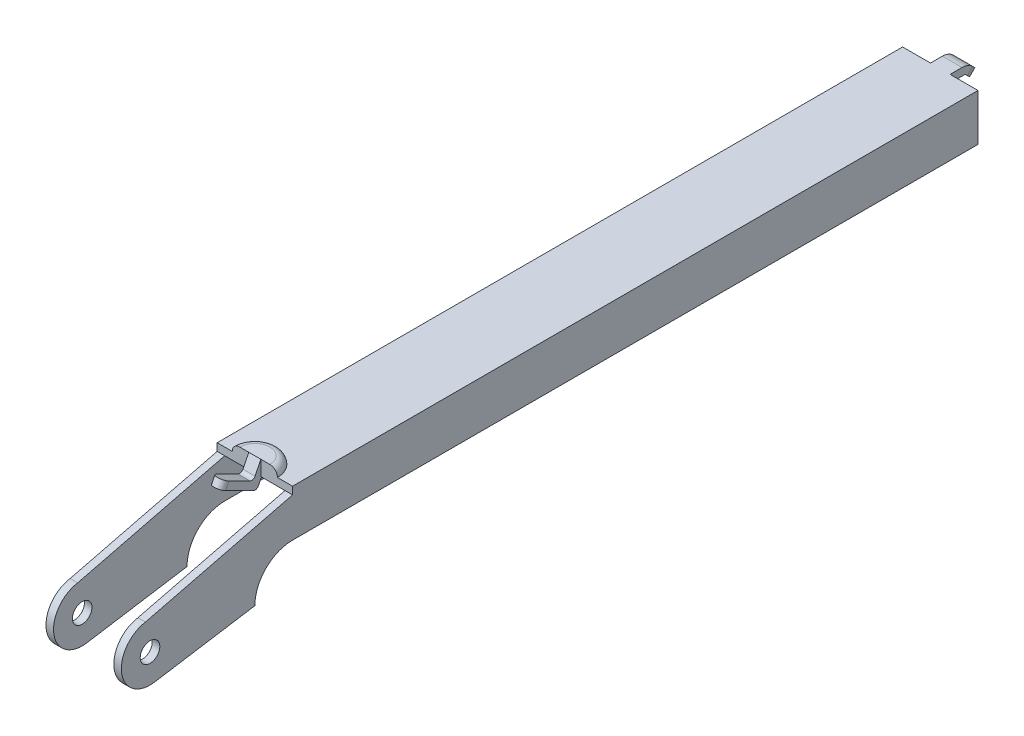
from build123d import *

# Parameters (mm, degrees)
SKETCH1_W                = 12.7
SKETCH1_H                = 115.490625
BOSS_EXTRUDE1_DEPTH      = 1.27
SKETCH2_W                = 5.08
SKETCH2_H                = 24.638
CUT_EXTRUDE1_DEPTH       = 1.27
SKETCH3_R                = 1.778
CUT_EXTRUDE2_DEPTH       = 1.27
SKETCH4_R                = 1.778
CUT_EXTRUDE3_DEPTH       = 1.27
CUT_EXTRUDE4_DEPTH       = 1.27
REVOLVE1_ANGLE           = 180
BOSS_EXTRUDE2_DEPTH      = 1.651
BOSS_EXTRUDE2_DEPTH_BACK = 1.651
FILLET1_R                = 2.54
CUT_EXTRUDE5_START       = -1.27
CUT_EXTRUDE5_DEPTH       = 1.27
BOSS_EXTRUDE3_DEPTH      = 1.016
BOSS_EXTRUDE3_DEPTH_BACK = 1.016
FILLET2_R                = 0.635
FILLET3_R                = 0.635
FILLET4_R                = 0.635
CUT_EXTRUDE6_DEPTH       = 112.292512614
SKETCH13_W               = 115.490625
SKETCH13_H               = 7.874
BOSS_EXTRUDE4_DEPTH      = 1.27
FILLET6_R                = 0.635
BOSS_EXTRUDE5_DEPTH      = 1.27
CUT_EXTRUDE7_REACH       = 147.742
SKETCH16_R               = 1.651


# Read off the part's stored shape, not the designer's step: Cut-Extrude5
with BuildPart() as part:
    # Sketch1 → Boss-Extrude1 (new body)
    with BuildSketch(Plane(origin=(0, 0, 0), x_dir=(1, 0, 0), z_dir=(0, 1, 0))):
        with Locations((6.35, -57.7453125)):
            Rectangle(SKETCH1_W, SKETCH1_H)
    boss_extrude1 = extrude(amount=BOSS_EXTRUDE1_DEPTH)

    # Sketch2 → Cut-Extrude1 (cut)
    with BuildSketch(Plane(origin=(0, 1.27, 0), x_dir=(1, 0, 0), z_dir=(0, 1, 0))):
        with Locations((6.35, -33.147)):
            Rectangle(SKETCH2_W, SKETCH2_H)
    extrude(amount=-CUT_EXTRUDE1_DEPTH, mode=Mode.SUBTRACT)

    # Sketch3 → Cut-Extrude2 (cut)
    with BuildSketch(Plane(origin=(0, 1.27, 0), x_dir=(1, 0, 0), z_dir=(0, 1, 0))):
        with Locations(Location((6.35, -58.674, 0), (0, 0, 270))):
            Circle(SKETCH3_R)
    extrude(amount=-CUT_EXTRUDE2_DEPTH, mode=Mode.SUBTRACT)

    # Sketch4 → Cut-Extrude3 (cut)
    with BuildSketch(Plane(origin=(0, 1.27, 0), x_dir=(1, 0, 0), z_dir=(0, 1, 0))):
        with Locations(Location((6.35, -113.03, 0), (0, 0, 270))):
            Circle(SKETCH4_R)
    extrude(amount=-CUT_EXTRUDE3_DEPTH, mode=Mode.SUBTRACT)

    # Sketch5 → Cut-Extrude4 (cut)
    with BuildSketch(Plane(origin=(0, 1.27, 0), x_dir=(1, 0, 0), z_dir=(0, 1, 0))):
        Polygon((5.077023467, -4.318), (7.62, -4.318), (8.89, -5.588), (8.89, -13.208), (3.81, -13.208), (3.81, -5.585023467), align=None)
    extrude(amount=-CUT_EXTRUDE4_DEPTH, mode=Mode.SUBTRACT)

    # Sketch6 → Revolve1 (revolve)
    with BuildSketch(Plane.XY.offset(115.490625)):
        with BuildLine():
            Line((6.35, 1.27), (10.16, 1.27))
            ThreePointArc((10.16, 1.27), (9.788025612, 2.168025612), (8.89, 2.54))
            Line((8.89, 2.54), (6.35, 2.54))
            Line((6.35, 2.54), (6.35, 1.27))
        make_face()
    revolve(axis=Axis((6.35, 1.27, 115.490625), (0, 1, 0)), revolution_arc=REVOLVE1_ANGLE)

    # Sketch7 → Boss-Extrude2 (add, two sides: drawn at the far end of the back side and taken through both)
    with BuildSketch(Plane(origin=(6.35, 0, 0), x_dir=(0, 0, -1), z_dir=(1, 0, 0)).offset(-BOSS_EXTRUDE2_DEPTH_BACK)):
        Polygon((0, 1.27), (3.066051224, 1.27), (4.964704214, -0.62865299), (4.066678602, -1.526678602), (2.54, 0), (0, 0), align=None)
    extrude(amount=BOSS_EXTRUDE2_DEPTH + BOSS_EXTRUDE2_DEPTH_BACK)

    # Fillet1
    fillet1_edges = [part.edges().sort_by_distance(p)[0] for p in [
        (6.35, 1.27, -3.066051224),
    ]]
    fillet(fillet1_edges, radius=FILLET1_R)

    # Cut-Extrude5 outline → Cut-Extrude5 (cut)
    with BuildSketch(Plane(origin=(0, 2.168025612, -2.168025612), x_dir=(1, 0, 0), z_dir=(0, 0.7071067811865515, -0.7071067811865437)).offset(CUT_EXTRUDE5_START)):
        with BuildLine():
            ThreePointArc((4.699, 2.322102448), (5.179912981, 3.474187827), (6.33199836, 3.955100809))
            Line((6.33199836, 3.955100809), (4.699, 3.955100809))
            Line((4.699, 3.955100809), (4.699, 2.322102448))
        make_face()
    cut_extrude5 = extrude(amount=CUT_EXTRUDE5_DEPTH, mode=Mode.SUBTRACT)

    # Mirror1: Cut-Extrude5 across plane
    add(cut_extrude5.mirror(Plane(origin=(6.35, 0, 0), x_dir=(0, 0, 1), z_dir=(1, 0, 0))), mode=Mode.SUBTRACT)

    # Sketch11 → Boss-Extrude3 (add, two sides: drawn at the far end of the back side and taken through both)
    with BuildSketch(Plane(origin=(6.35, 0, 0), x_dir=(0, 0, -1), z_dir=(1, 0, 0)).offset(-BOSS_EXTRUDE3_DEPTH_BACK)):
        Polygon((-115.340721834, 0), (-116.192663734, -1.703883799), (-122.345747046, 1.372657857), (-121.77778578, 2.50858039), (-116.760625, 0), (-115.490625, 2.54), (-115.490625, 0), align=None)
    extrude(amount=BOSS_EXTRUDE3_DEPTH + BOSS_EXTRUDE3_DEPTH_BACK)

    # Fillet2
    fillet2_edges = [part.edges().sort_by_distance(p)[0] for p in [
        (6.35, 0, 116.760625),
    ]]
    fillet(fillet2_edges, radius=FILLET2_R)

    # Fillet3
    fillet3_edges = [part.edges().sort_by_distance(p)[0] for p in [
        (6.35, -1.703883799, 116.192663734),
    ]]
    fillet(fillet3_edges, radius=FILLET3_R)

    # Fillet4
    fillet4_edges = [part.edges().sort_by_distance(p)[0] for p in [
        (6.35, 0, 115.340721834),
    ]]
    fillet(fillet4_edges, radius=FILLET4_R)

    # Sketch12 → Cut-Extrude6 (cut, through all)
    with BuildSketch(Plane(origin=(0, -46.70425, 23.352125), x_dir=(1, 0, 0), z_dir=(0, 0.8944271909999153, -0.4472135954999592))):
        with BuildLine():
            Line((6.35, -110.043234117), (7.366, -110.043234117))
            Line((7.366, -110.043234117), (7.366, -109.027234117))
            ThreePointArc((7.366, -109.027234117), (7.06842049, -109.745654607), (6.35, -110.043234117))
        make_face()
    cut_extrude6 = extrude(amount=-CUT_EXTRUDE6_DEPTH, mode=Mode.SUBTRACT)

    # Mirror2: Cut-Extrude6 across plane
    add(cut_extrude6.mirror(Plane(origin=(6.35, 0, 0), x_dir=(0, 0, 1), z_dir=(1, 0, 0))), mode=Mode.SUBTRACT)

    # Sketch13 → Boss-Extrude4 (add)
    with BuildSketch(Plane(origin=(0, 0, 0), x_dir=(0, 0, -1), z_dir=(1, 0, 0))):
        with Locations((-57.7453125, -2.667)):
            Rectangle(SKETCH13_W, SKETCH13_H)
    boss_extrude4 = extrude(amount=BOSS_EXTRUDE4_DEPTH)

    # Fillet6
    fillet6_edges = [part.edges().sort_by_distance(p)[0] for p in [
        (0, 1.27, 57.7453125),
    ]]
    fillet(fillet6_edges, radius=FILLET6_R)

    # Sketch14 → Boss-Extrude5 (add)
    with BuildSketch(Plane(origin=(0, 0, 0), x_dir=(0, 0, -1), z_dir=(1, 0, 0))):
        with BuildLine():
            Line((-121.834273366, -12.993842066), (-138.745315854, -15.689805361))
            ThreePointArc((-138.745315854, -15.689805361), (-144.2709028, -11.683754825), (-140.264852264, -6.158167879))
            Line((-140.264852264, -6.158167879), (-115.490625, 0))
            Line((-115.490625, 0), (-115.490625, -6.604))
            ThreePointArc((-115.490625, -6.604), (-119.99078577, -8.48018731), (-121.834273366, -12.993842066))
        make_face()
    boss_extrude5 = extrude(amount=BOSS_EXTRUDE5_DEPTH)

    # Mirror3: Boss-Extrude1, Boss-Extrude4, Boss-Extrude5 across plane
    add(boss_extrude1.mirror(Plane(origin=(6.35, 0, 0), x_dir=(0, 0, 1), z_dir=(1, 0, 0))))
    add(boss_extrude4.mirror(Plane(origin=(6.35, 0, 0), x_dir=(0, 0, 1), z_dir=(1, 0, 0))))
    add(boss_extrude5.mirror(Plane(origin=(6.35, 0, 0), x_dir=(0, 0, 1), z_dir=(1, 0, 0))))

    # Cut-Extrude7: up to this face of the body (flat: up to its plane)
    cut_extrude7_end = Plane(part.part.faces().sort_by_distance((12.7, -4.009508171, 74.287192312))[0])
    # Sketch16 → Cut-Extrude7 (cut, up to the picked face)
    with BuildSketch(Plane.ZY, mode=Mode.PRIVATE) as cut_extrude7_sk1:
        with Locations((139.505084059, -10.92398662)):
            Circle(SKETCH16_R)
    cut_extrude7_tool1 = split(extrude(cut_extrude7_sk1.sketch, amount=-CUT_EXTRUDE7_REACH, mode=Mode.PRIVATE), bisect_by=cut_extrude7_end, keep=Keep.BOTH, mode=Mode.PRIVATE)
    add(cut_extrude7_tool1.solids().sort_by(Axis((0, -10.923987, 139.505084), (1, 0, 0)))[0], mode=Mode.SUBTRACT)


solid = part.part
